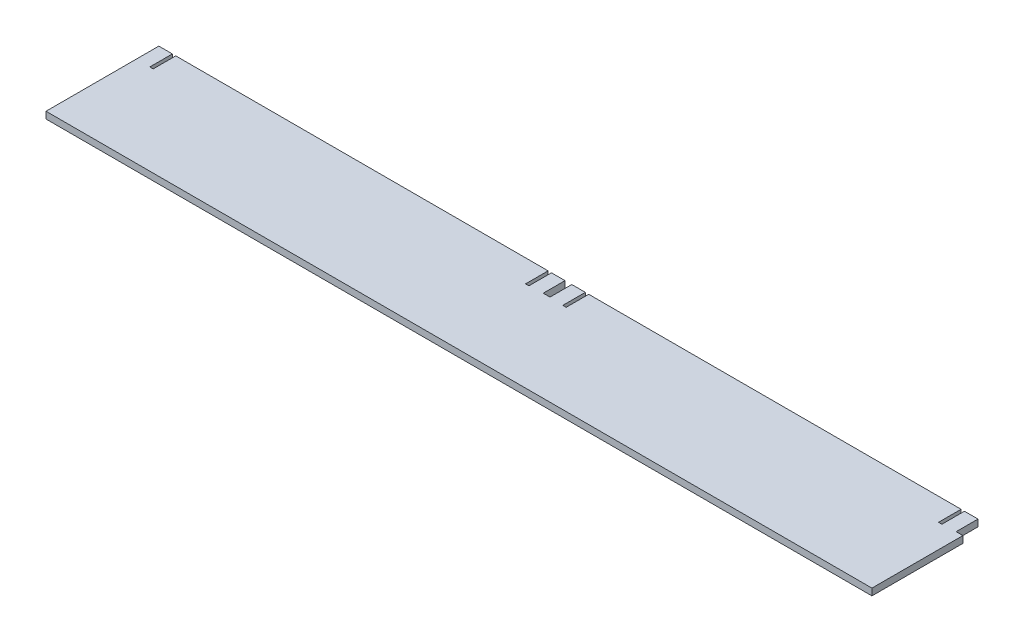
from build123d import *

# Parameters (mm, degrees)
BOSS_EXTRUDE1_DEPTH = 1.5
SKETCH2_W           = 3
SKETCH2_H           = 40.331406252
BOSS_EXTRUDE2_DEPTH = 1.5
LPATTERN2_COUNT     = 2
LPATTERN2_PITCH     = 183


with BuildPart() as part:
    # Sketch1 → Boss-Extrude1 (new, symmetric)
    with BuildSketch(Plane(origin=(0, 0, 0), x_dir=(1, 0, 0), z_dir=(0, 1, 0))):
        Polygon((-84, 25), (-84, 15), (-82.5, 15), (-82.5, 25), (82.5, 25), (82.5, 15), (84, 15), (84, 25), (90, 25), (90, -25), (-90, -25), (-90, 25), align=None)
    boss_extrude1 = extrude(amount=BOSS_EXTRUDE1_DEPTH, both=True)

    # Sketch2 → Boss-Extrude2 (add, symmetric)
    with BuildSketch(Plane(origin=(0, 0, 0), x_dir=(1, 0, 0), z_dir=(0, 1, 0))):
        with Locations((91.5, -4.834296874)):
            Rectangle(SKETCH2_W, SKETCH2_H)
    boss_extrude2 = extrude(amount=BOSS_EXTRUDE2_DEPTH, both=True)

    # LPattern2: Boss-Extrude1, Boss-Extrude2 ×2
    with Locations(*[(i * LPATTERN2_PITCH, 0, 0) for i in range(1, LPATTERN2_COUNT)]):
        add(boss_extrude1)
        add(boss_extrude2)


solid = part.part
